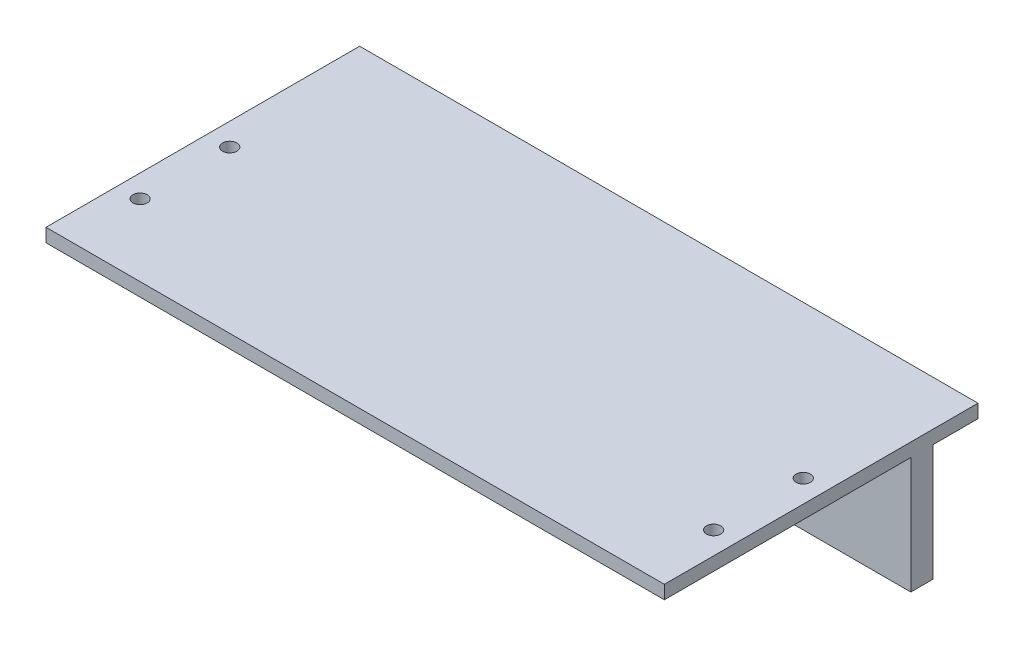
from build123d import *

# Parameters (mm, degrees)
SKETCH_1_W          = 138
SKETCH_1_H          = 26
SKETCH_1_R          = 2.1
EXTRUDE_1_DEPTH     = 5
SKETCH_2_W          = 138
SKETCH_2_H          = 70
EXTRUDE_2_DEPTH     = 3
SKETCH_3_R          = 1.6
CUT_EXTRUDE_1_DEPTH = 3


with BuildPart() as part:
    # 草图1 → 凸台-拉伸1 (new body)
    with BuildSketch(Plane.XY):
        with Locations((19.202020202, 1.570004208)):
            Rectangle(SKETCH_1_W, SKETCH_1_H)
        with Locations((-29.797979798, -1.429995792)):
            Circle(SKETCH_1_R, mode=Mode.SUBTRACT)
        with Locations((68.202020202, -1.429995792)):
            Circle(SKETCH_1_R, mode=Mode.SUBTRACT)
    extrude(amount=EXTRUDE_1_DEPTH)

    # 草图2 → 凸台-拉伸2 (add)
    with BuildSketch(Plane(origin=(0, 14.570004208, 0), x_dir=(1, 0, 0), z_dir=(0, 1, 0))):
        with Locations((19.202020202, -25)):
            Rectangle(SKETCH_2_W, SKETCH_2_H)
    extrude(amount=EXTRUDE_2_DEPTH)

    # 草图3 → 切除-拉伸1 (cut)
    with BuildSketch(Plane(origin=(0, 17.570004208, 0), x_dir=(1, 0, 0), z_dir=(0, 1, 0))):
        with Locations((-44.797979798, -24)):
            Circle(SKETCH_3_R)
        with Locations((-44.797979798, -44)):
            Circle(SKETCH_3_R)
        with Locations((83.202020202, -24)):
            Circle(SKETCH_3_R)
        with Locations((83.202020202, -44)):
            Circle(SKETCH_3_R)
    extrude(amount=-CUT_EXTRUDE_1_DEPTH, mode=Mode.SUBTRACT)


solid = part.part
